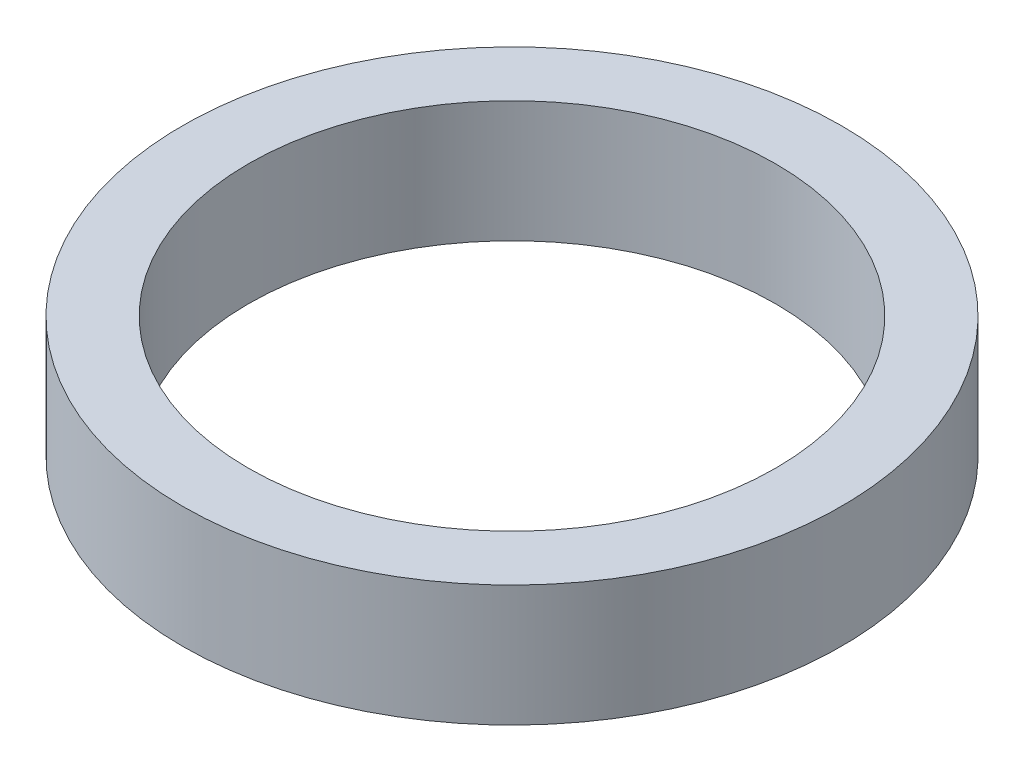
from build123d import *

# Parameters (mm, degrees)
SKETCH1_R           = 62.5
BOSS_EXTRUDE1_DEPTH = 23
SKETCH2_R           = 50
CUT_EXTRUDE1_DEPTH  = 92.331812639


with BuildPart() as part:
    # Sketch1 → Boss-Extrude1 (new body)
    with BuildSketch(Plane(origin=(0, 0, 0), x_dir=(1, 0, 0), z_dir=(0, 1, 0))):
        Circle(SKETCH1_R)
    extrude(amount=BOSS_EXTRUDE1_DEPTH)

    # Sketch2 → Cut-Extrude1 (cut, through all)
    with BuildSketch(Plane(origin=(0, 0, 0), x_dir=(1, 0, 0), z_dir=(0, 1, 0))):
        Circle(SKETCH2_R)
    extrude(amount=CUT_EXTRUDE1_DEPTH, mode=Mode.SUBTRACT)


solid = part.part
